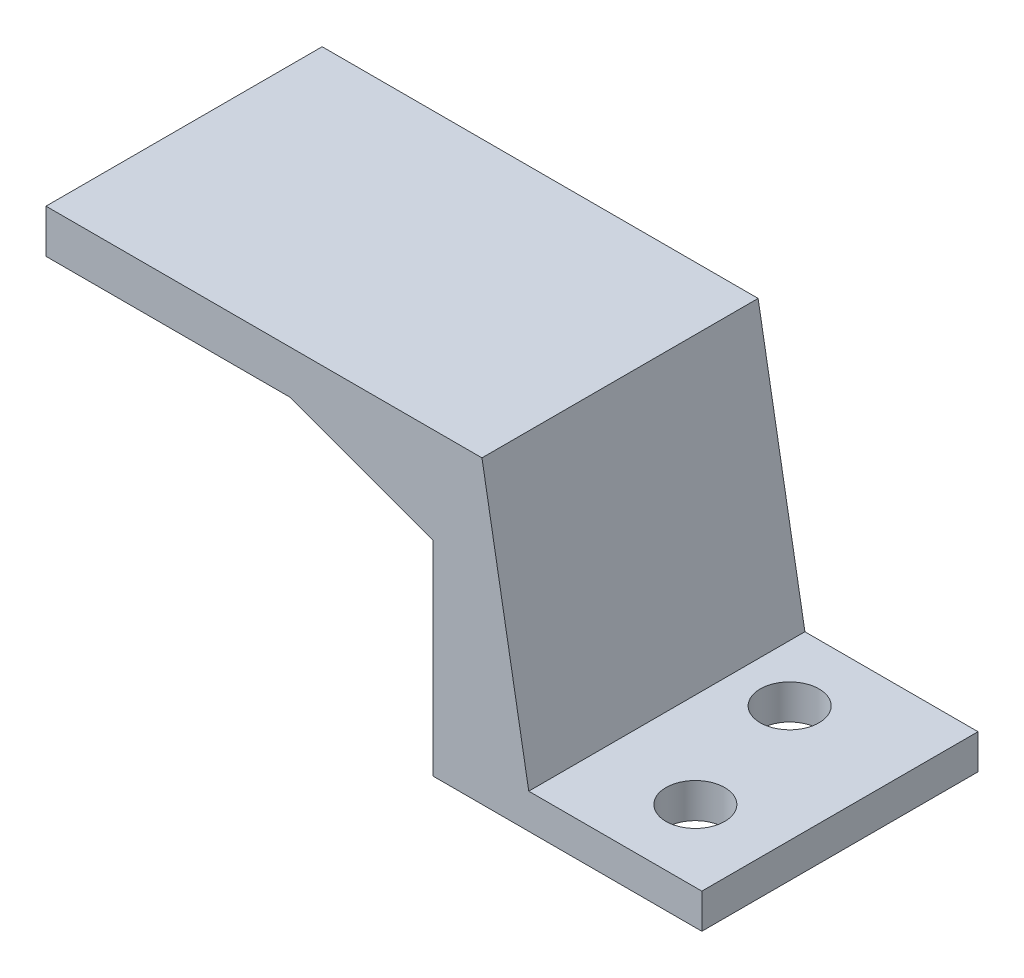
from build123d import *

# Parameters (mm, degrees)
BOSS_EXTRUDE1_DEPTH     = 31.75
F_1_4_CLEARANCE_HOLE1_D = 6.7564
CHAMFER1_SIZE           = 5.5
CHAMFER1_SIZE_2         = 31.192050008
CHAMFER2_SIZE           = 6
CHAMFER2_SIZE2          = 16.484864517


with BuildPart() as part:
    # Sketch1 → Boss-Extrude1 (new body)
    with BuildSketch(Plane.XY):
        Polygon((30.9, 0), (0, 0), (0, 29.5), (5.5, 29.5), (5.5, 4), (30.9, 4), align=None)
        Polygon((-44.5, 29.5), (0, 29.5), (5.5, 29.5), (5.5, 34.5), (-44.5, 34.5), align=None)
    extrude(amount=BOSS_EXTRUDE1_DEPTH)

    # 1/4 Clearance Hole1 (through all)
    with Locations(Plane(origin=(0, 4, 0), x_dir=(1, 0, 0), z_dir=(0, 1, 0))):
        with Locations((21.9, -23.495), (17.5, -8.255)):
            Hole(F_1_4_CLEARANCE_HOLE1_D / 2)

    # Chamfer1
    # the kernel refuses this chamfer: 31.192050008, 5.5 mm, written as the material it adds along each edge
    with BuildSketch(Plane(origin=(5.5, 4, 0), x_dir=(0.9776715712462578, -0.21013876076743532, 0), z_dir=(0, 0, 1))) as chamfer1_piece_1_section:
        Polygon((CHAMFER1_SIZE * 0.977671571246, CHAMFER1_SIZE * 0.210138760767), (-CHAMFER1_SIZE_2 * 0.210138760767, CHAMFER1_SIZE_2 * 0.977671571243), (0, 0), align=None)
    chamfer1_piece_1 = extrude(amount=31.75, mode=Mode.PRIVATE)
    chamfer1_piece_1 = split(chamfer1_piece_1, bisect_by=Plane(origin=(7.01069263, 34.5, 15.875), z_dir=(0, -1, 0)), keep=Keep.TOP, mode=Mode.PRIVATE)
    add(chamfer1_piece_1)

    # Chamfer2
    chamfer2_edges = [part.edges().sort_by_distance(p)[0] for p in [
        (0, 29.5, 15.875),
    ]]
    chamfer2_side = [part.faces().sort_by_distance(p)[0] for p in [
        (0, 14.75, 15.875),
    ]]
    chamfer(chamfer2_edges, length=CHAMFER2_SIZE, length2=CHAMFER2_SIZE2, reference=chamfer2_side[0])


solid = part.part
